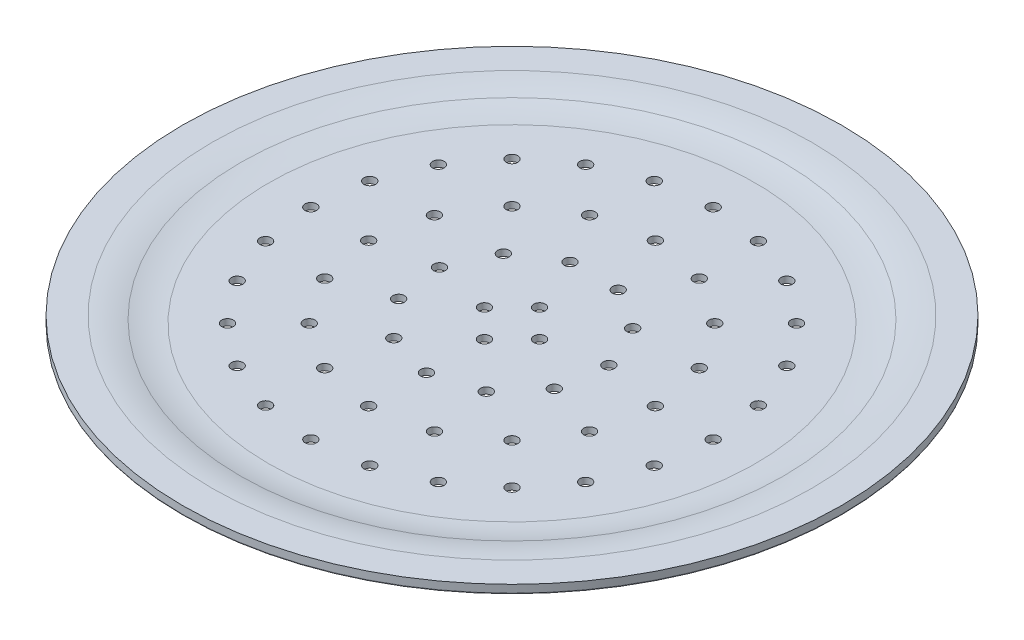
from build123d import *

# Parameters (mm, degrees)
SKETCH1_R             = 28.5
BOSS_EXTRUDE1_DEPTH   = 0.75
SKETCH2_R             = 22.5
BOSS_EXTRUDE2_DEPTH   = 0.4
FILLET1_R             = 0.3
FILLET2_R             = 0.1
FILLET3_R             = 0.1
SKETCH3_R             = 22.5
CUT_EXTRUDE1_DEPTH    = 0.6
FILLET4_R             = 10.1
FILLET5_R             = 10.1
SKETCH6_R             = 0.5
CUT_EXTRUDE3_DEPTH    = 41.321489308
CIRPATTERN1_START     = -1.15
CIRPATTERN1_OUTLINE_R = 0.5
CIRPATTERN1_DEPTH     = 0.55
SKETCH7_R             = 0.5
CUT_EXTRUDE4_DEPTH    = 41.321489308
CIRPATTERN2_COUNT     = 16
SKETCH8_R             = 0.5
CUT_EXTRUDE5_DEPTH    = 41.321489308
CIRPATTERN3_COUNT     = 11
SKETCH9_R             = 0.5
CUT_EXTRUDE6_DEPTH    = 41.321489308
CIRPATTERN4_COUNT     = 4


with BuildPart() as part:
    # Sketch1 → Boss-Extrude1 (new body)
    with BuildSketch(Plane(origin=(0, 0, 0), x_dir=(1, 0, 0), z_dir=(0, 1, 0))):
        with Locations(Location((0, 0, 0), (0, 0, 270))):
            Circle(SKETCH1_R)
    extrude(amount=-BOSS_EXTRUDE1_DEPTH)

    # Sketch2 → Boss-Extrude2 (add)
    with BuildSketch(Plane(origin=(0, -0.75, 0), x_dir=(1, 0, 0), z_dir=(0, 1, 0))):
        with Locations(Location((0, 0, 0), (0, 0, 270))):
            Circle(SKETCH2_R)
    extrude(amount=-BOSS_EXTRUDE2_DEPTH)

    # Fillet1
    fillet1_edges = [part.edges().sort_by_distance(p)[0] for p in [
        (0, -0.75, -22.5),
    ]]
    fillet(fillet1_edges, radius=FILLET1_R)

    # Fillet2
    fillet2_edges = [part.edges().sort_by_distance(p)[0] for p in [
        (0, -1.15, -22.5),
    ]]
    fillet(fillet2_edges, radius=FILLET2_R - 0.0001)  # a hair under: the kernel refuses the full size

    # Fillet3
    fillet3_edges = [part.edges().sort_by_distance(p)[0] for p in [
        (0, -0.75, -28.5),
    ]]
    fillet(fillet3_edges, radius=FILLET3_R)

    # Sketch3 → Cut-Extrude1 (cut)
    with BuildSketch(Plane(origin=(0, 0, 0), x_dir=(1, 0, 0), z_dir=(0, 1, 0))):
        with Locations(Location((0, 0, 0), (0, 0, 270))):
            Circle(SKETCH3_R)
    extrude(amount=-CUT_EXTRUDE1_DEPTH, mode=Mode.SUBTRACT)

    # Fillet4
    # the kernel refuses this fillet: 10.1 mm, written as the material it takes off along each edge
    with BuildSketch(Plane(origin=(0, 0, 0), x_dir=(0, 0, 1), z_dir=(-1, 0, 0))) as fillet4_piece_1:
        with BuildLine():
            CenterArc((25.92928564, -10.1), FILLET4_R, 90, 19.848438581)
            Line((22.5, -0.6), (22.5, 0))
            Line((22.5, 0), (25.92928564, 0))
        make_face()
    revolve(axis=Axis((0, 0, 0), (0, 1, 0)), mode=Mode.SUBTRACT)

    # Fillet5
    fillet5_edges = [part.edges().sort_by_distance(p)[0] for p in [
        (0, -0.6, -22.5),
    ]]
    fillet(fillet5_edges, radius=FILLET5_R)

    # Sketch6 → Cut-Extrude3 (cut, symmetric)
    with BuildSketch(Plane(origin=(0, 0, 0), x_dir=(1, 0, 0), z_dir=(0, 1, 0))):
        with Locations(Location((0, -17.4, 0), (0, 0, 270))):
            Circle(SKETCH6_R)
    extrude(amount=CUT_EXTRUDE3_DEPTH, both=True, mode=Mode.SUBTRACT)

    # CirPattern1: read off the stored shape, not the designer's step
    # CirPattern1 outline → CirPattern1 (cut)
    with BuildSketch(Plane(origin=(0, 0, 0), x_dir=(1, 0, 0), z_dir=(0, 1, 0)).offset(CIRPATTERN1_START)):
        with Locations((-4.503451385, -16.807109377)):
            Circle(CIRPATTERN1_OUTLINE_R)
        with Locations((4.503451385, -16.807109377)):
            Circle(CIRPATTERN1_OUTLINE_R)
        with Locations((8.7, -15.068842026)):
            Circle(CIRPATTERN1_OUTLINE_R)
        with Locations((12.303657993, -12.303657993)):
            Circle(CIRPATTERN1_OUTLINE_R)
        with Locations((15.068842026, -8.7)):
            Circle(CIRPATTERN1_OUTLINE_R)
        with Locations((16.807109377, -4.503451385)):
            Circle(CIRPATTERN1_OUTLINE_R)
        with Locations((17.4, 0)):
            Circle(CIRPATTERN1_OUTLINE_R)
        with Locations((-8.7, -15.068842026)):
            Circle(CIRPATTERN1_OUTLINE_R)
        with Locations((-12.303657993, -12.303657993)):
            Circle(CIRPATTERN1_OUTLINE_R)
        with Locations((-15.068842026, -8.7)):
            Circle(CIRPATTERN1_OUTLINE_R)
        with Locations((-16.807109377, -4.503451385)):
            Circle(CIRPATTERN1_OUTLINE_R)
        with Locations((-17.4, 0)):
            Circle(CIRPATTERN1_OUTLINE_R)
        with Locations((-16.807109377, 4.503451385)):
            Circle(CIRPATTERN1_OUTLINE_R)
        with Locations((-15.068842026, 8.7)):
            Circle(CIRPATTERN1_OUTLINE_R)
        with Locations((-12.303657993, 12.303657993)):
            Circle(CIRPATTERN1_OUTLINE_R)
        with Locations((-8.7, 15.068842026)):
            Circle(CIRPATTERN1_OUTLINE_R)
        with Locations((-4.503451385, 16.807109377)):
            Circle(CIRPATTERN1_OUTLINE_R)
        with Locations((0, 17.4)):
            Circle(CIRPATTERN1_OUTLINE_R)
        with Locations((4.503451385, 16.807109377)):
            Circle(CIRPATTERN1_OUTLINE_R)
        with Locations((8.7, 15.068842026)):
            Circle(CIRPATTERN1_OUTLINE_R)
        with Locations((12.303657993, 12.303657993)):
            Circle(CIRPATTERN1_OUTLINE_R)
        with Locations((15.068842026, 8.7)):
            Circle(CIRPATTERN1_OUTLINE_R)
        with Locations((16.807109377, 4.503451385)):
            Circle(CIRPATTERN1_OUTLINE_R)
    extrude(amount=CIRPATTERN1_DEPTH, mode=Mode.SUBTRACT)

    # Sketch7 → Cut-Extrude4 (cut, symmetric)
    with BuildSketch(Plane(origin=(0, 0, 0), x_dir=(1, 0, 0), z_dir=(0, 1, 0))):
        with Locations(Location((0, -12.4, 0), (0, 0, 270))):
            Circle(SKETCH7_R)
    cut_extrude4 = extrude(amount=CUT_EXTRUDE4_DEPTH, both=True, mode=Mode.SUBTRACT)

    # CirPattern2: Cut-Extrude4 ×16 about axis
    cirpattern2_axis = Axis((0, 0, 0), (0, 1, 0))
    for i in range(1, CIRPATTERN2_COUNT):
        add(cut_extrude4.rotate(cirpattern2_axis, i * 360 / CIRPATTERN2_COUNT), mode=Mode.SUBTRACT)

    # Sketch8 → Cut-Extrude5 (cut, symmetric)
    with BuildSketch(Plane(origin=(0, 0, 0), x_dir=(1, 0, 0), z_dir=(0, 1, 0))):
        with Locations(Location((0, -7.4, 0), (0, 0, 270))):
            Circle(SKETCH8_R)
    cut_extrude5 = extrude(amount=CUT_EXTRUDE5_DEPTH, both=True, mode=Mode.SUBTRACT)

    # CirPattern3: Cut-Extrude5 ×11 about axis
    cirpattern3_axis = Axis((0, 0, 0), (0, 1, 0))
    for i in range(1, CIRPATTERN3_COUNT):
        add(cut_extrude5.rotate(cirpattern3_axis, i * 360 / CIRPATTERN3_COUNT), mode=Mode.SUBTRACT)

    # Sketch9 → Cut-Extrude6 (cut, symmetric)
    with BuildSketch(Plane(origin=(0, 0, 0), x_dir=(1, 0, 0), z_dir=(0, 1, 0))):
        with Locations(Location((0, -2.385513904, 0), (0, 0, 270))):
            Circle(SKETCH9_R)
    cut_extrude6 = extrude(amount=CUT_EXTRUDE6_DEPTH, both=True, mode=Mode.SUBTRACT)

    # CirPattern4: Cut-Extrude6 ×4 about axis
    cirpattern4_axis = Axis((0, 0, 0), (0, 1, 0))
    for i in range(1, CIRPATTERN4_COUNT):
        add(cut_extrude6.rotate(cirpattern4_axis, i * 360 / CIRPATTERN4_COUNT), mode=Mode.SUBTRACT)


solid = part.part
